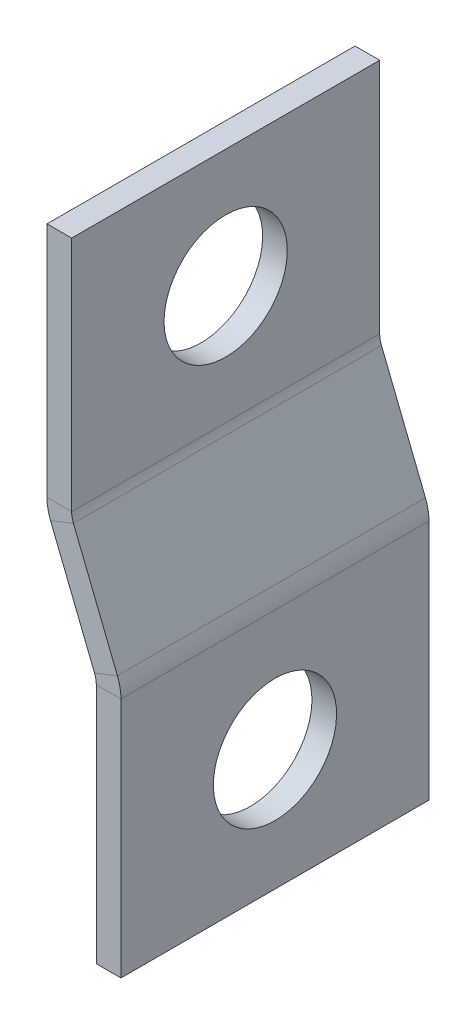
from build123d import *

# Parameters (mm, degrees)
FLANGE_BASE1_DEPTH    = 12.5
ESBO_O3_R             = 5
CORTE_EXTRUS_O1_DEPTH = 10


# Sheet-metal steps are written as plain solids
with BuildPart() as part:
    # Esboço1 → Flange-base1 (new, symmetric)
    with BuildSketch(Plane.XY):
        with BuildLine():
            Line((0, 0), (0, -19.229670386))
            ThreePointArc((0, -19.229670386), (0.072174453, -19.98610047), (0.286093236, -20.715233091))
            Line((0.286093236, -20.715233091), (3.856953382, -29.642383454))
            ThreePointArc((3.856953382, -29.642383454), (3.963912773, -30.006949765), (4, -30.385164807))
            Line((4, -30.385164807), (4, -50))
            Line((4, -50), (6, -50))
            Line((6, -50), (6, -30.385164807))
            ThreePointArc((6, -30.385164807), (5.927825547, -29.628734723), (5.713906764, -28.899602102))
            Line((5.713906764, -28.899602102), (2.143046618, -19.972451738))
            ThreePointArc((2.143046618, -19.972451738), (2.036087227, -19.607885428), (2, -19.229670386))
            Line((2, -19.229670386), (2, 0))
            Line((2, 0), (0, 0))
        make_face()
    extrude(amount=FLANGE_BASE1_DEPTH, both=True)

    # Esboço3 → Corte-extrusão1 (cut)
    with BuildSketch(Plane(origin=(6, 0, 0), x_dir=(0, 0, -1), z_dir=(1, 0, 0))):
        with Locations(Location((0, -40.192582404, 0), (0, 0, 90))):
            Circle(ESBO_O3_R)
        with Locations(Location((0, -9.614835193, 0), (0, 0, 90))):
            Circle(ESBO_O3_R)
    extrude(amount=-CORTE_EXTRUS_O1_DEPTH, mode=Mode.SUBTRACT)


solid = part.part
